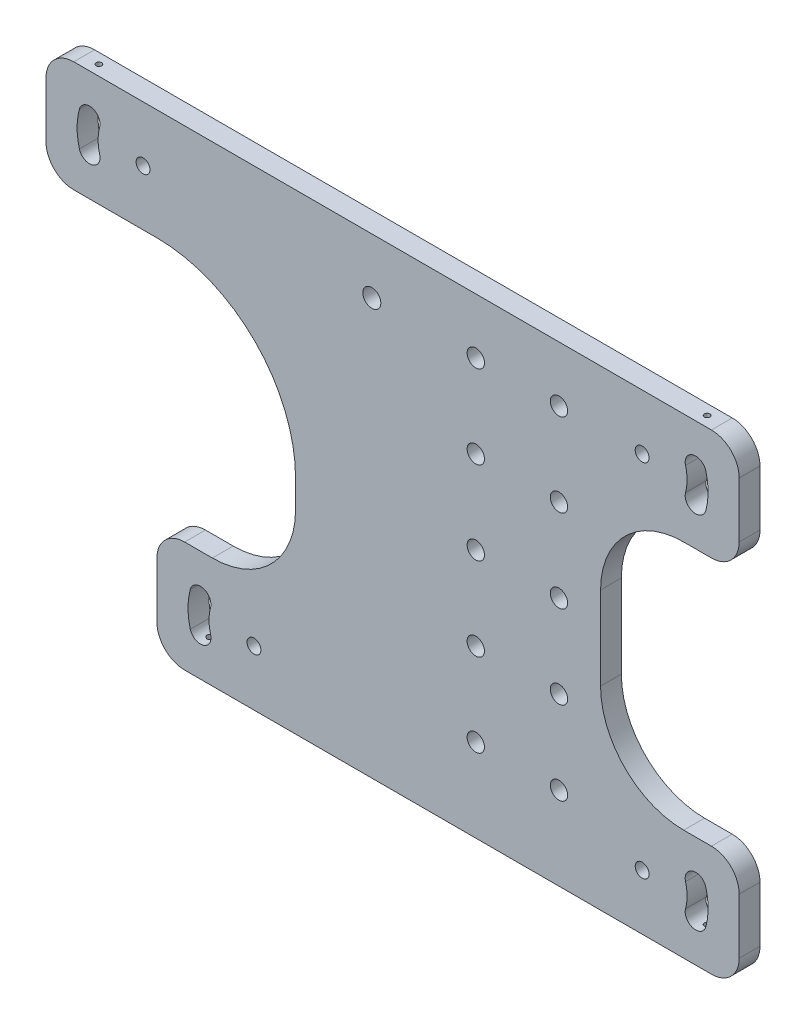
from build123d import *

# Parameters (mm, degrees)
MODEL_R             = 7.9375
MODEL_R_2           = 6.35
MODEL_R_3           = 8.255
BOSS_EXTRUDE1_DEPTH = 19.05
CUT_EXTRUDE1_REACH  = 981.781
SKETCH4_R           = 2.5527
CUT_EXTRUDE2_REACH  = 981.781
SKETCH5_R           = 2.5527


with BuildPart() as part:
    # Model → Boss-Extrude1 (new body)
    with BuildSketch(Plane.XY):
        with BuildLine():
            Line((828.492770102, 541.610844847), (853.892770102, 541.610844847))
            ThreePointArc((853.892770102, 541.610844847), (871.853282344, 549.050332605), (879.292770102, 567.010844847))
            Line((879.292770102, 567.010844847), (879.292770102, 617.810844847))
            ThreePointArc((879.292770102, 617.810844847), (871.853282344, 635.771357089), (853.892770102, 643.210844847))
            Line((853.892770102, 643.210844847), (269.692770102, 643.210844847))
            ThreePointArc((269.692770102, 643.210844847), (251.73225786, 635.771357089), (244.292770102, 617.810844847))
            Line((244.292770102, 617.810844847), (244.292770102, 567.010844847))
            ThreePointArc((244.292770102, 567.010844847), (251.73225786, 549.050332605), (269.692770102, 541.610844847))
            Line((269.692770102, 541.610844847), (345.892770102, 541.610844847))
            ThreePointArc((345.892770102, 541.610844847), (435.695331313, 504.413406058), (472.892770102, 414.610844847))
            Line((472.892770102, 414.610844847), (472.892770102, 389.210844847))
            ThreePointArc((472.892770102, 389.210844847), (450.574306828, 335.329308121), (396.692770102, 313.010844847))
            Line((396.692770102, 313.010844847), (371.292770102, 313.010844847))
            ThreePointArc((371.292770102, 313.010844847), (353.33225786, 305.571357089), (345.892770102, 287.610844847))
            Line((345.892770102, 287.610844847), (345.892770102, 236.810844847))
            ThreePointArc((345.892770102, 236.810844847), (353.33225786, 218.850332605), (371.292770102, 211.410844847))
            Line((371.292770102, 211.410844847), (853.892770102, 211.410844847))
            ThreePointArc((853.892770102, 211.410844847), (871.853282344, 218.850332605), (879.292770102, 236.810844847))
            Line((879.292770102, 236.810844847), (879.292770102, 287.610844847))
            ThreePointArc((879.292770102, 287.610844847), (871.853282344, 305.571357089), (853.892770102, 313.010844847))
            Line((853.892770102, 313.010844847), (828.492770102, 313.010844847))
            ThreePointArc((828.492770102, 313.010844847), (774.611233376, 335.329308121), (752.292770102, 389.210844847))
            Line((752.292770102, 389.210844847), (752.292770102, 465.410844847))
            ThreePointArc((752.292770102, 465.410844847), (774.611233376, 519.292381574), (828.492770102, 541.610844847))
        make_face()
        with Locations((714.192770102, 287.610844847)):
            Circle(MODEL_R, mode=Mode.SUBTRACT)
        with Locations((714.192770102, 440.010844847)):
            Circle(MODEL_R, mode=Mode.SUBTRACT)
        with Locations((714.192770102, 363.810844847)):
            Circle(MODEL_R, mode=Mode.SUBTRACT)
        with Locations((790.392770102, 592.410844847)):
            Circle(MODEL_R_2, mode=Mode.SUBTRACT)
        with Locations((714.192770102, 516.210844847)):
            Circle(MODEL_R, mode=Mode.SUBTRACT)
        with Locations((714.192770102, 592.410844847)):
            Circle(MODEL_R, mode=Mode.SUBTRACT)
        with Locations((542.742770102, 592.410844847)):
            Circle(MODEL_R_3, mode=Mode.SUBTRACT)
        with Locations((637.992770102, 592.410844847)):
            Circle(MODEL_R, mode=Mode.SUBTRACT)
        with Locations((637.992770102, 516.210844847)):
            Circle(MODEL_R, mode=Mode.SUBTRACT)
        with Locations((333.192770102, 592.410844847)):
            Circle(MODEL_R_2, mode=Mode.SUBTRACT)
        with Locations((637.992770102, 363.810844847)):
            Circle(MODEL_R, mode=Mode.SUBTRACT)
        with Locations((790.392770102, 262.210844847)):
            Circle(MODEL_R_2, mode=Mode.SUBTRACT)
        with Locations((637.992770102, 440.010844847)):
            Circle(MODEL_R, mode=Mode.SUBTRACT)
        with Locations((637.992770102, 287.610844847)):
            Circle(MODEL_R, mode=Mode.SUBTRACT)
        with Locations((434.792770102, 262.210844847)):
            Circle(MODEL_R_2, mode=Mode.SUBTRACT)
        with BuildLine():
            ThreePointArc((395.033495737, 273.000428495), (393.613020102, 262.210844847), (395.033495737, 251.4212612))
            ThreePointArc((395.033495737, 251.4212612), (388.230951725, 239.638909351), (376.448599876, 246.441453362))
            ThreePointArc((376.448599876, 246.441453362), (374.372520102, 262.210844847), (376.448599876, 277.980236332))
            ThreePointArc((376.448599876, 277.980236332), (388.230951725, 284.782780344), (395.033495737, 273.000428495))
        make_face(mode=Mode.SUBTRACT)
        with BuildLine():
            ThreePointArc((848.736940328, 246.441453362), (850.813020102, 262.210844847), (848.736940328, 277.980236332))
            ThreePointArc((848.736940328, 277.980236332), (836.954588479, 284.782780344), (830.152044467, 273.000428495))
            ThreePointArc((830.152044467, 273.000428495), (831.572520102, 262.210844847), (830.152044467, 251.4212612))
            ThreePointArc((830.152044467, 251.4212612), (836.954588479, 239.638909351), (848.736940328, 246.441453362))
        make_face(mode=Mode.SUBTRACT)
        with BuildLine():
            ThreePointArc((274.848599876, 608.180236332), (272.772520102, 592.410844847), (274.848599876, 576.641453362))
            ThreePointArc((274.848599876, 576.641453362), (286.630951725, 569.838909351), (293.433495737, 581.6212612))
            ThreePointArc((293.433495737, 581.6212612), (292.013020102, 592.410844847), (293.433495737, 603.200428495))
            ThreePointArc((293.433495737, 603.200428495), (286.630951725, 614.982780344), (274.848599876, 608.180236332))
        make_face(mode=Mode.SUBTRACT)
        with BuildLine():
            ThreePointArc((830.152044467, 581.6212612), (831.572520102, 592.410844847), (830.152044467, 603.200428495))
            ThreePointArc((830.152044467, 603.200428495), (836.954588479, 614.982780344), (848.736940328, 608.180236332))
            ThreePointArc((848.736940328, 608.180236332), (850.813020102, 592.410844847), (848.736940328, 576.641453362))
            ThreePointArc((848.736940328, 576.641453362), (836.954588479, 569.838909351), (830.152044467, 581.6212612))
        make_face(mode=Mode.SUBTRACT)
    extrude(amount=BOSS_EXTRUDE1_DEPTH)

    # Sketch4 → Cut-Extrude1 (cut, up to next)
    with BuildSketch(Plane.XZ.offset(-211.410844847), mode=Mode.PRIVATE) as cut_extrude1_sk1:
        with Locations((384.754770102, 9.525)):
            Circle(SKETCH4_R)
    cut_extrude1_tool1 = extrude(cut_extrude1_sk1.sketch, amount=-CUT_EXTRUDE1_REACH, mode=Mode.PRIVATE) & part.part
    # Sketch4 → Cut-Extrude1 (cut, up to next)
    with BuildSketch(Plane.XZ.offset(-211.410844847), mode=Mode.PRIVATE) as cut_extrude1_sk2:
        with Locations((840.430770102, 9.525)):
            Circle(SKETCH4_R)
    cut_extrude1_tool2 = extrude(cut_extrude1_sk2.sketch, amount=-CUT_EXTRUDE1_REACH, mode=Mode.PRIVATE) & part.part
    add(cut_extrude1_tool1.solids().sort_by_distance((384.75477, 211.410845, 9.525))[0], mode=Mode.SUBTRACT)
    add(cut_extrude1_tool2.solids().sort_by_distance((840.43077, 211.410845, 9.525))[0], mode=Mode.SUBTRACT)

    # Sketch5 → Cut-Extrude2 (cut, up to next)
    with BuildSketch(Plane(origin=(0, 643.210844847, 0), x_dir=(1, 0, 0), z_dir=(0, 1, 0)), mode=Mode.PRIVATE) as cut_extrude2_sk1:
        with Locations((283.154770102, -9.525)):
            Circle(SKETCH5_R)
    cut_extrude2_tool1 = extrude(cut_extrude2_sk1.sketch, amount=-CUT_EXTRUDE2_REACH, mode=Mode.PRIVATE) & part.part
    # Sketch5 → Cut-Extrude2 (cut, up to next)
    with BuildSketch(Plane(origin=(0, 643.210844847, 0), x_dir=(1, 0, 0), z_dir=(0, 1, 0)), mode=Mode.PRIVATE) as cut_extrude2_sk2:
        with Locations((840.430770102, -9.525)):
            Circle(SKETCH5_R)
    cut_extrude2_tool2 = extrude(cut_extrude2_sk2.sketch, amount=-CUT_EXTRUDE2_REACH, mode=Mode.PRIVATE) & part.part
    add(cut_extrude2_tool1.solids().sort_by_distance((283.15477, 643.210845, 9.525))[0], mode=Mode.SUBTRACT)
    add(cut_extrude2_tool2.solids().sort_by_distance((840.43077, 643.210845, 9.525))[0], mode=Mode.SUBTRACT)


solid = part.part
